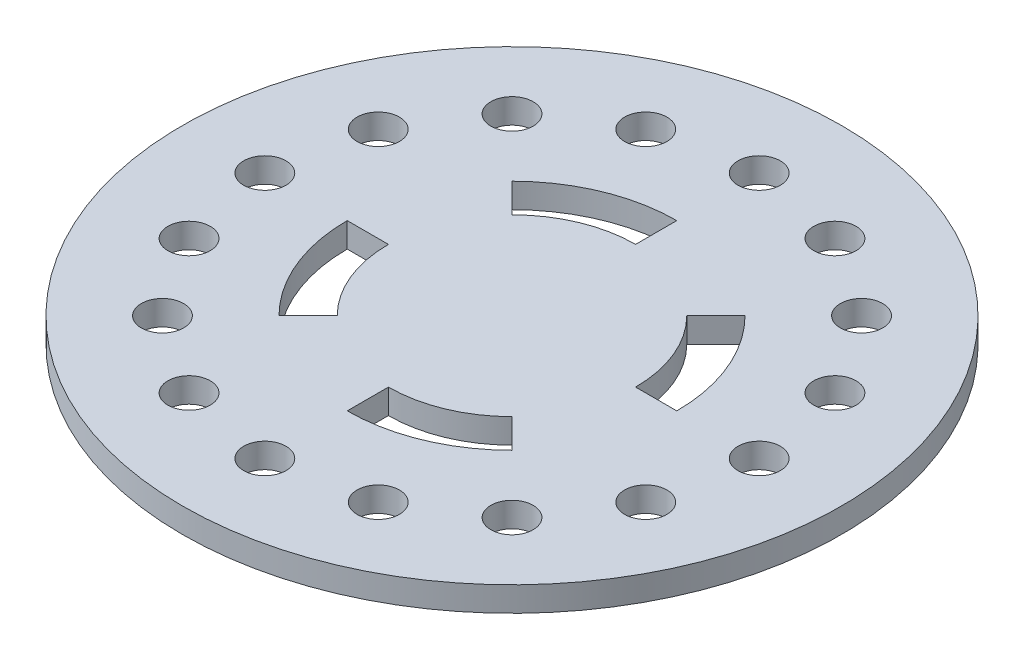
from build123d import *

# Parameters (mm, degrees)
SKETCH1_R           = 50.8
BOSS_EXTRUDE1_DEPTH = 3.81
CUT_EXTRUDE1_DEPTH  = 72.943005914
SKETCH3_R           = 3.2639
CUT_EXTRUDE2_DEPTH  = 72.943005914


with BuildPart() as part:
    # Sketch1 → Boss-Extrude1 (new body)
    with BuildSketch(Plane(origin=(0, 0, 0), x_dir=(1, 0, 0), z_dir=(0, 1, 0))):
        Circle(SKETCH1_R)
    extrude(amount=BOSS_EXTRUDE1_DEPTH)

    # Sketch2 → Cut-Extrude1 (cut, through all)
    with BuildSketch(Plane(origin=(0, 3.81, 0), x_dir=(1, 0, 0), z_dir=(0, 1, 0))):
        with BuildLine():
            ThreePointArc((-13.470384182, 13.470384182), (-7.290119387, 17.599905094), (0, 19.05))
            Line((0, 19.05), (0, 25.4))
            ThreePointArc((0, 25.4), (-9.720159182, 23.466540126), (-17.960512242, 17.960512242))
            Line((-17.960512242, 17.960512242), (-13.470384182, 13.470384182))
        make_face()
        with BuildLine():
            Line((17.960512242, 17.960512242), (13.470384182, 13.470384182))
            ThreePointArc((13.470384182, 13.470384182), (17.599905094, 7.290119387), (19.05, 0))
            Line((19.05, 0), (25.4, 0))
            ThreePointArc((25.4, 0), (23.466540126, 9.720159182), (17.960512242, 17.960512242))
        make_face()
        with BuildLine():
            Line((17.960512242, -17.960512242), (13.470384182, -13.470384182))
            ThreePointArc((13.470384182, -13.470384182), (7.290119387, -17.599905094), (0, -19.05))
            Line((0, -19.05), (0, -25.4))
            ThreePointArc((0, -25.4), (9.720159182, -23.466540126), (17.960512242, -17.960512242))
        make_face()
        with BuildLine():
            Line((-17.960512242, -17.960512242), (-13.470384182, -13.470384182))
            ThreePointArc((-13.470384182, -13.470384182), (-17.599905094, -7.290119387), (-19.05, 0))
            Line((-19.05, 0), (-25.4, 0))
            ThreePointArc((-25.4, 0), (-23.466540126, -9.720159182), (-17.960512242, -17.960512242))
        make_face()
    extrude(amount=-CUT_EXTRUDE1_DEPTH, mode=Mode.SUBTRACT)

    # Sketch3 → Cut-Extrude2 (cut, through all)
    with BuildSketch(Plane(origin=(0, 3.81, 0), x_dir=(1, 0, 0), z_dir=(0, 1, 0))):
        with Locations((14.580238773, 35.199810189)):
            Circle(SKETCH3_R)
        with Locations((26.940768363, 26.940768363)):
            Circle(SKETCH3_R)
        with Locations((35.199810189, 14.580238773)):
            Circle(SKETCH3_R)
        with Locations((38.1, 0)):
            Circle(SKETCH3_R)
        with Locations((35.199810189, -14.580238773)):
            Circle(SKETCH3_R)
        with Locations((26.940768363, -26.940768363)):
            Circle(SKETCH3_R)
        with Locations((14.580238773, -35.199810189)):
            Circle(SKETCH3_R)
        with Locations((0, -38.1)):
            Circle(SKETCH3_R)
        with Locations((-14.580238773, -35.199810189)):
            Circle(SKETCH3_R)
        with Locations((-26.940768363, -26.940768363)):
            Circle(SKETCH3_R)
        with Locations((-35.199810189, -14.580238773)):
            Circle(SKETCH3_R)
        with Locations((-38.1, 0)):
            Circle(SKETCH3_R)
        with Locations((-35.199810189, 14.580238773)):
            Circle(SKETCH3_R)
        with Locations((-26.940768363, 26.940768363)):
            Circle(SKETCH3_R)
        with Locations((-14.580238773, 35.199810189)):
            Circle(SKETCH3_R)
        with Locations((0, 38.1)):
            Circle(SKETCH3_R)
    extrude(amount=-CUT_EXTRUDE2_DEPTH, mode=Mode.SUBTRACT)


solid = part.part
